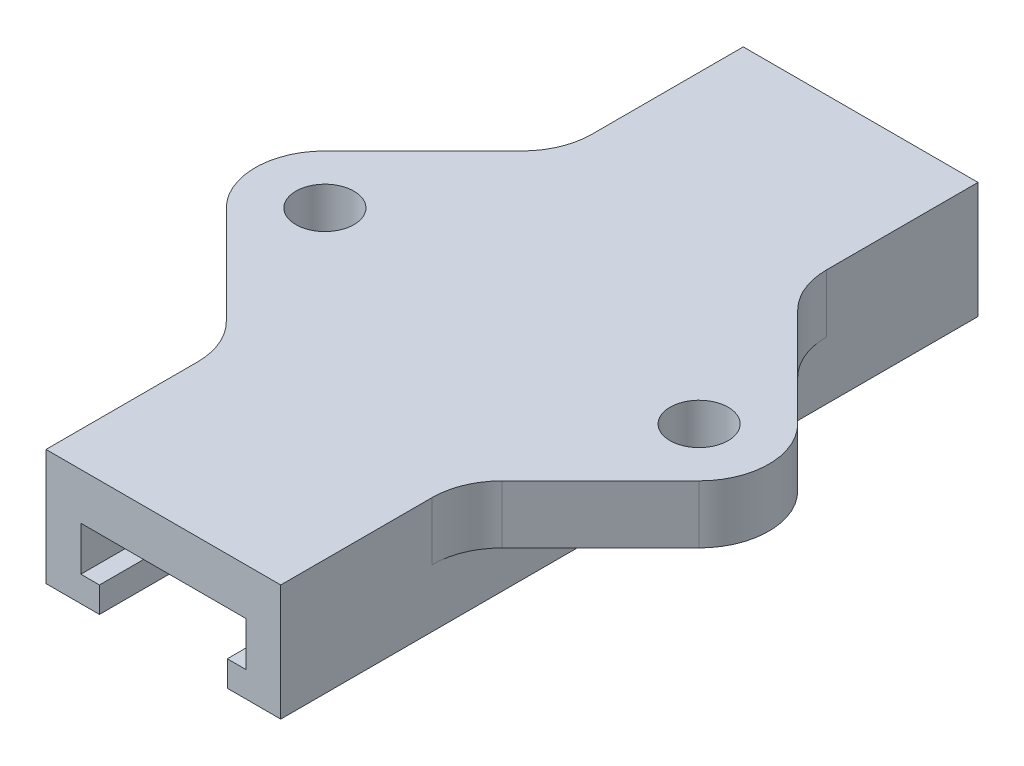
from build123d import *

# Parameters (mm, degrees)
BOSS_EXTRUDE1_DEPTH = 38.1
BOSS_EXTRUDE2_DEPTH = 1.27
SKETCH3_R           = 3.175
BOSS_EXTRUDE3_DEPTH = 6.35


with BuildPart() as part:
    # Sketch1 → Boss-Extrude1 (new, symmetric)
    with BuildSketch(Plane.XY):
        Polygon((-12.827, 0), (12.827, 0), (12.827, -12.7), (6.985, -12.7), (6.985, -9.906), (9.017, -9.906), (9.017, -5.08), (-9.017, -5.08), (-9.017, -9.906), (-6.985, -9.906), (-6.985, -12.7), (-12.827, -12.7), align=None)
    extrude(amount=BOSS_EXTRUDE1_DEPTH, both=True)

    # Sketch2 → Boss-Extrude2 (add, symmetric)
    with BuildSketch(Plane(origin=(0, 0, 0), x_dir=(0, 0, -1), z_dir=(1, 0, 0))):
        Polygon((6.858, -5.08), (8.720666667, -7.874), (10.075333333, -7.874), (11.938, -5.08), align=None)
    extrude(amount=BOSS_EXTRUDE2_DEPTH, both=True)

    # Sketch3 → Boss-Extrude3 (add)
    # profile 1 of 2: a face of its own
    with BuildSketch(Plane(origin=(0, 0, 0), x_dir=(1, 0, 0), z_dir=(0, 1, 0))):
        with BuildLine():
            Line((25.835153673, 5.388153673), (15.058846327, 16.164461018))
            ThreePointArc((15.058846327, 16.164461018), (13.407037962, 18.636566936), (12.827, 21.552614691))
            Line((12.827, 21.552614691), (12.827, -21.552614691))
            ThreePointArc((12.827, -21.552614691), (13.407037962, -18.636566936), (15.058846327, -16.164461018))
            Line((15.058846327, -16.164461018), (25.835153673, -5.388153673))
            ThreePointArc((25.835153673, -5.388153673), (28.067, 0), (25.835153673, 5.388153673))
        make_face()
        with Locations((20.447, 0)):
            Circle(SKETCH3_R, mode=Mode.SUBTRACT)
    # profile 2 of 2: a face of its own
    with BuildSketch(Plane(origin=(0, 0, 0), x_dir=(1, 0, 0), z_dir=(0, 1, 0))):
        with BuildLine():
            Line((-25.835153673, -5.388153673), (-15.058846327, -16.164461018))
            ThreePointArc((-15.058846327, -16.164461018), (-13.407037962, -18.636566936), (-12.827, -21.552614691))
            Line((-12.827, -21.552614691), (-12.827, 21.552614691))
            ThreePointArc((-12.827, 21.552614691), (-13.407037962, 18.636566936), (-15.058846327, 16.164461018))
            Line((-15.058846327, 16.164461018), (-25.835153673, 5.388153673))
            ThreePointArc((-25.835153673, 5.388153673), (-28.067, 0), (-25.835153673, -5.388153673))
        make_face()
        with Locations((-20.447, 0)):
            Circle(SKETCH3_R, mode=Mode.SUBTRACT)
    extrude(amount=-BOSS_EXTRUDE3_DEPTH)


solid = part.part
